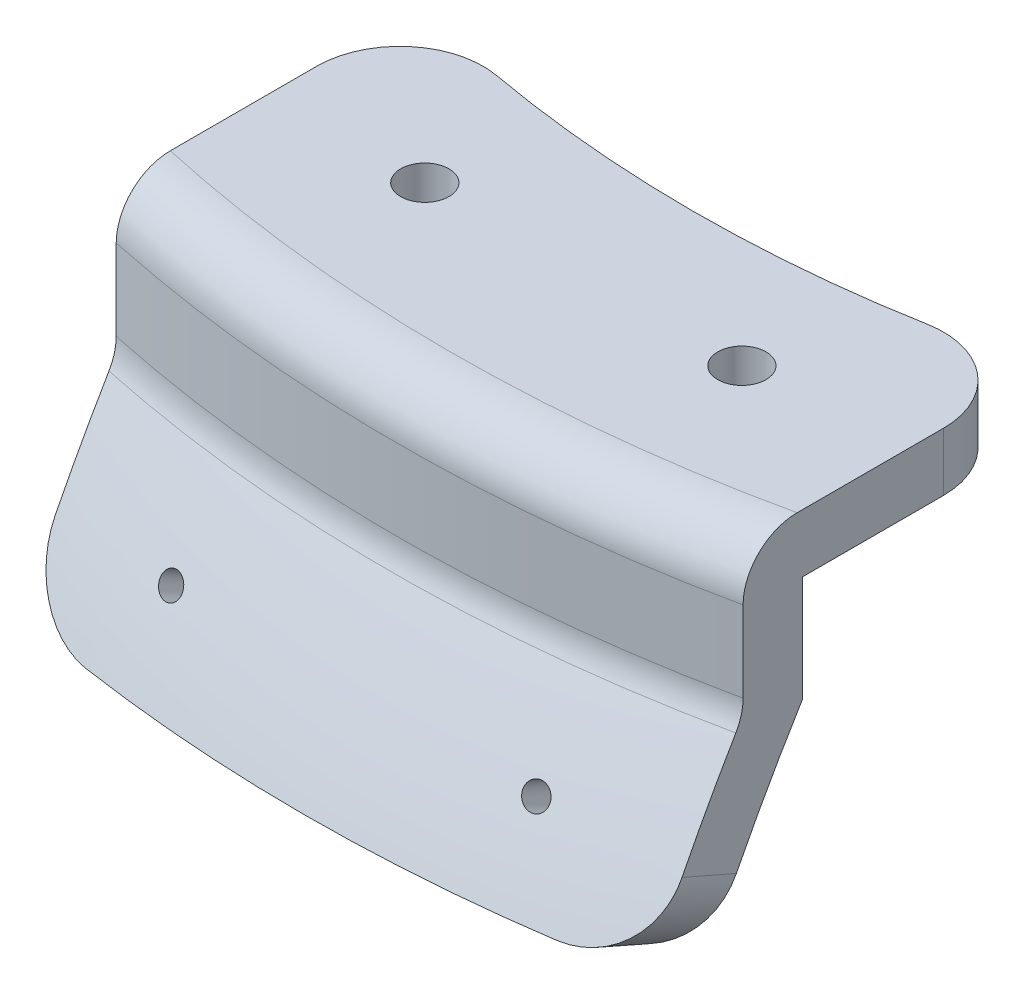
from build123d import *

# Parameters (mm, degrees)
REVOLVE1_ANGLE      = 30
FILLET1_R           = 6.35
SKETCH3_R           = 2.9
CUT_EXTRUDE1_DEPTH  = 204.02156921
SKETCH4_OUTSIDE_W   = 125.474
SKETCH4_OUTSIDE_H   = 77.633
SKETCH4_OUTSIDE_W_2 = 75.329921726
SKETCH4_OUTSIDE_H_2 = 51.667493695
CUT_EXTRUDE2_DEPTH  = 204.02156921
FILLET2_R           = 10


with BuildPart() as part:
    # Sketch2 → Revolve1 (revolve, symmetric)
    with BuildSketch(Plane(origin=(0, 0, 0), x_dir=(0, 0, -1), z_dir=(1, 0, 0))) as revolve1_sk:
        with BuildLine():
            Line((-174.101233777, 209.400503093), (-174.101233777, 196.700503093))
            ThreePointArc((-174.101233777, 196.700503093), (-180.321192386, 185.592119355), (-185.833303485, 174.116026572))
            Line((-185.833303485, 174.116026572), (-192.235041302, 176.94759026))
            ThreePointArc((-192.235041302, 176.94759026), (-186.982593651, 187.948677967), (-181.101233777, 198.626774384))
            Line((-181.101233777, 198.626774384), (-181.101233777, 216.400503093))
            Line((-181.101233777, 216.400503093), (-145.526233777, 216.400503093))
            Line((-145.526233777, 216.400503093), (-145.526233777, 209.400503093))
            Line((-145.526233777, 209.400503093), (-174.101233777, 209.400503093))
        make_face()
    revolve(axis=Axis((0, 91.919777778, 0), (0, 1, 0)), revolution_arc=REVOLVE1_ANGLE / 2)
    revolve(revolve1_sk.sketch, axis=Axis((0, 91.919777778, 0), (0, -1, 0)), revolution_arc=REVOLVE1_ANGLE / 2)

    # Fillet1
    fillet1_edges = [part.edges().sort_by_distance(p)[0] for p in [
        (0, 198.626774384, 181.101233777),
        (0, 216.400503093, 181.101233777),
    ]]
    fillet(fillet1_edges, radius=FILLET1_R)

    # Sketch3 → Cut-Extrude1 (cut, through all)
    with BuildSketch(Plane.XZ.offset(-216.400503093)):
        with Locations((19.05, 158.674245572)):
            Circle(SKETCH3_R)
        with Locations((-19.05, 158.674245572)):
            Circle(SKETCH3_R)
    extrude(amount=CUT_EXTRUDE1_DEPTH, mode=Mode.SUBTRACT)

    # Sketch4 outside → Cut-Extrude2 (cut, through all)
    with BuildSketch(Plane(origin=(0, 216.400503093, 0), x_dir=(1, 0, 0), z_dir=(0, 1, 0))):
        with Locations((0, -166.4015)):
            Rectangle(SKETCH4_OUTSIDE_W, SKETCH4_OUTSIDE_H)
        with Locations((0, -166.401294455)):
            Rectangle(SKETCH4_OUTSIDE_W_2, SKETCH4_OUTSIDE_H_2, mode=Mode.SUBTRACT)
    extrude(amount=-CUT_EXTRUDE2_DEPTH, mode=Mode.SUBTRACT)

    # Fillet2
    fillet2_edges = [part.edges().sort_by_distance(p)[0] for p in [
        (-37.664960863, 175.531391116, 185.242847006),
        (-37.664960863, 212.900503093, 140.567547607),
        (37.664960863, 212.900503093, 140.567547607),
        (37.664960863, 175.531391116, 185.242847006),
    ]]
    fillet(fillet2_edges, radius=FILLET2_R)

    # Sketch6 → Cut-Revolve1 (revolve, cut)
    with BuildSketch(Plane(origin=(0, 72.974433775, -37.182331171), x_dir=(0, 0.4539904997395446, 0.891006524188369), z_dir=(0, 0.8910065241883691, -0.45399049973954464))):
        Polygon((217.848132391, 19.059241955), (275.794196508, 24.128865661), (275.663462894, 25.623157708), (217.717398777, 20.553534002), align=None)
    cut_revolve1 = revolve(axis=Axis((19.059241955, 171.875416266, 156.921776072), (0.08715574274765917, 0.45226292882455627, 0.8876159753616077)), mode=Mode.SUBTRACT)

    # Mirror1: Cut-Revolve1 across plane
    add(cut_revolve1.mirror(Plane(origin=(0, 0, 0), x_dir=(0, 0, 1), z_dir=(1, 0, 0))), mode=Mode.SUBTRACT)


solid = part.part
